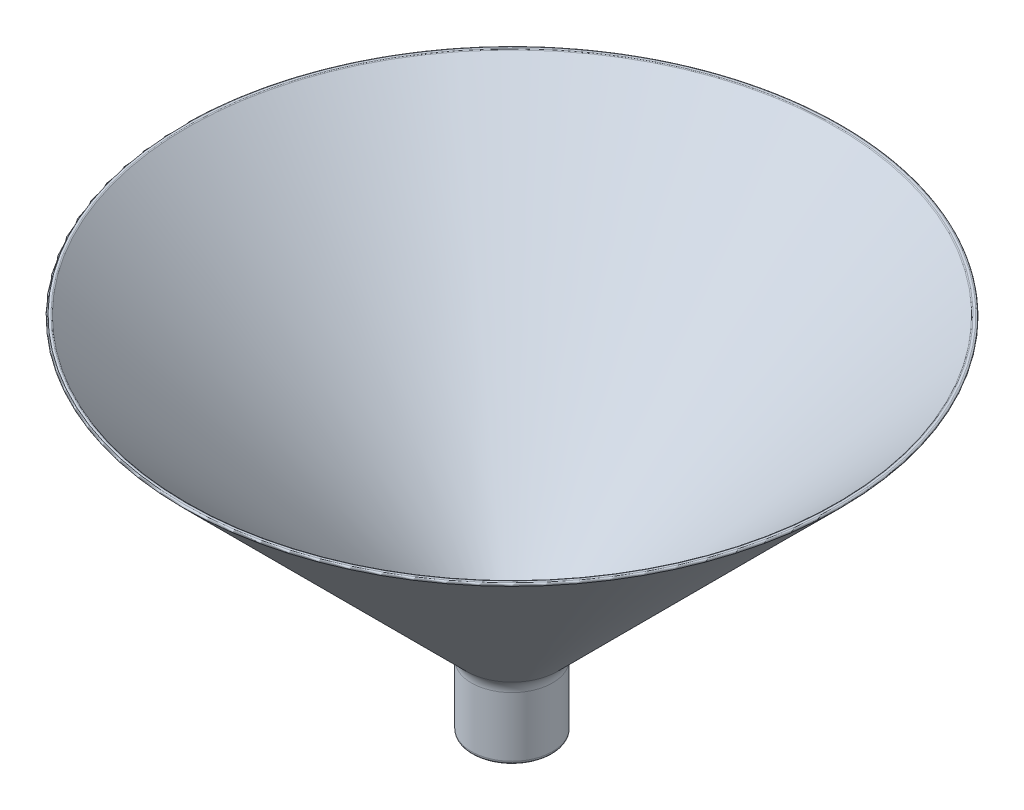
from build123d import *

# Parameters (mm, degrees)
FILLET1_R = 5
FILLET2_R = 0.4
FILLET3_R = 1


with BuildPart() as part:
    # Sketch1 → Revolve1 (revolve)
    with BuildSketch(Plane.XY):
        Polygon((10, 6.92820323), (10, 20), (90, 100), (91.697056275, 100), (11.2, 19.502943725), (11.2, 6.606664199), (11.2, 0), (6, 0), align=None)
    revolve(axis=Axis((0, 0, 0), (0, 1, 0)))

    # Fillet1
    fillet1_edges = [part.edges().sort_by_distance(p)[0] for p in [
        (-11.2, 19.502943725, 0),
        (-10, 20, 0),
    ]]
    fillet(fillet1_edges, radius=FILLET1_R)

    # Fillet2
    fillet2_edges = [part.edges().sort_by_distance(p)[0] for p in [
        (-90, 100, 0),
        (-91.697056275, 100, 0),
    ]]
    fillet(fillet2_edges, radius=FILLET2_R)

    # Fillet3
    fillet3_edges = [part.edges().sort_by_distance(p)[0] for p in [
        (-11.2, 0, 0),
    ]]
    fillet(fillet3_edges, radius=FILLET3_R)


solid = part.part
